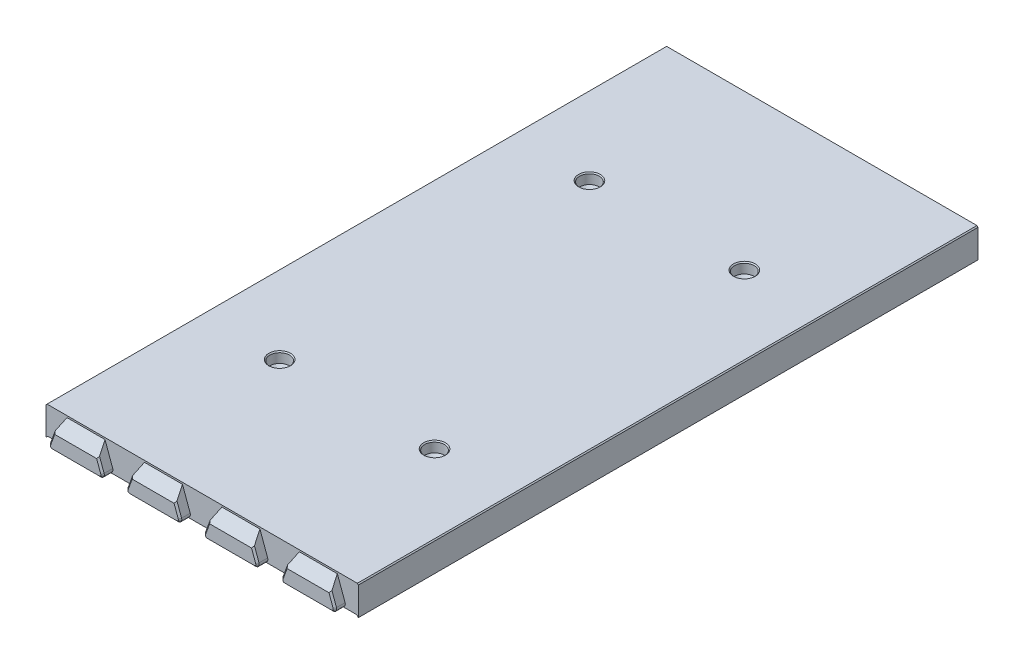
from build123d import *

# Parameters (mm, degrees)
BOSS_EXTRUDE1_DEPTH             = 90
SKETCH7_W                       = 86.75
SKETCH7_H                       = 6
BOSS_EXTRUDE7_DEPTH             = 1
BOSS_EXTRUDE4_DEPTH             = 3
BOSS_EXTRUDE8_REACH             = 103.108
BOSS_EXTRUDE8_DIRECTION_2_DEPTH = 2
CHAMFER4_SIZE                   = 0.5
FILLET4_R                       = 1
CHAMFER6_SIZE                   = 0.5
FILLET2_R                       = 2
CHAMFER4_OF_MIRROR2_SIZE        = 0.5
FILLET4_OF_MIRROR2_R            = 1
CHAMFER6_OF_MIRROR2_SIZE        = 0.5
FILLET2_OF_MIRROR2_R            = 2
BOSS_EXTRUDE9_REACH             = 190.711
SKETCH9_R                       = 5
FILLET3_R                       = 3
SKETCH10_R                      = 1.85
CUT_EXTRUDE2_DEPTH              = 189.711130104
SKETCH11_R                      = 2.85
CUT_EXTRUDE3_DEPTH              = 3
CHAMFER7_SIZE                   = 1
CUT_EXTRUDE4_DEPTH              = 189.711130104
CUT_EXTRUDE4_DEPTH_BACK         = 189.711130104
BOSS_EXTRUDE10_DEPTH            = 180
CHAMFER8_SIZE                   = 0.3


with BuildPart() as part:
    # Sketch1 → Boss-Extrude1 (new body)
    with BuildSketch(Plane.XY):
        Polygon((-45.375, 0), (-45.375, 8), (45.375, 8), (45.375, 0), (43.375, 0), (43.375, 6), (-43.375, 6), (-43.375, 0), align=None)
    boss_extrude1 = extrude(amount=-BOSS_EXTRUDE1_DEPTH)

    # Sketch7 → Boss-Extrude7 (add)
    with BuildSketch(Plane.XY):
        with Locations((0, 3)):
            Rectangle(SKETCH7_W, SKETCH7_H)
    boss_extrude7 = extrude(amount=-BOSS_EXTRUDE7_DEPTH)

    # Sketch2 → Boss-Extrude4 (add)
    with BuildSketch(Plane.XY):
        Polygon((28.411761874, 8), (25.5, 0), (42, 0), (39.088238126, 8), align=None)
        Polygon((5.911761874, 8), (3, 0), (19.5, 0), (16.588238126, 8), align=None)
        Polygon((-16.588238126, 8), (-19.5, 0), (-3, 0), (-5.911761874, 8), align=None)
        Polygon((-39.088238126, 8), (-42, 0), (-25.5, 0), (-28.411761874, 8), align=None)
    boss_extrude4 = extrude(amount=BOSS_EXTRUDE4_DEPTH)

    # Sketch8 → Boss-Extrude8 (add, up to next)
    with BuildSketch(Plane.XZ, mode=Mode.PRIVATE) as boss_extrude8_sk1:
        Polygon((-44, -24.955880937), (-44, -20.044119063), (-40, -21.5), (-40, -23.5), align=None)
    boss_extrude8_tool1 = extrude(boss_extrude8_sk1.sketch, amount=-BOSS_EXTRUDE8_REACH, mode=Mode.PRIVATE) - part.part
    # Sketch8 → Boss-Extrude8 (add, up to next)
    with BuildSketch(Plane.XZ, mode=Mode.PRIVATE) as boss_extrude8_sk2:
        Polygon((-44, -90), (-44, -87.544119063), (-40, -89), (-40, -90), align=None)
    boss_extrude8_tool2 = extrude(boss_extrude8_sk2.sketch, amount=-BOSS_EXTRUDE8_REACH, mode=Mode.PRIVATE) - part.part
    # Sketch8 → Boss-Extrude8 (add, up to next)
    with BuildSketch(Plane.XZ, mode=Mode.PRIVATE) as boss_extrude8_sk3:
        Polygon((44, -24.955880937), (40, -23.5), (40, -21.5), (44, -20.044119063), align=None)
    boss_extrude8_tool3 = extrude(boss_extrude8_sk3.sketch, amount=-BOSS_EXTRUDE8_REACH, mode=Mode.PRIVATE) - part.part
    # Sketch8 → Boss-Extrude8 (add, up to next)
    with BuildSketch(Plane.XZ, mode=Mode.PRIVATE) as boss_extrude8_sk4:
        Polygon((40, -90), (44, -90), (44, -87.544119063), (40, -89), align=None)
    boss_extrude8_tool4 = extrude(boss_extrude8_sk4.sketch, amount=-BOSS_EXTRUDE8_REACH, mode=Mode.PRIVATE) - part.part
    boss_extrude8_1 = boss_extrude8_tool1.solids().sort_by_distance((-42.280851, 0, -22.5))[0]
    add(boss_extrude8_1)
    boss_extrude8_2 = boss_extrude8_tool2.solids().sort_by_distance((-42.280851, 0, -89.084919))[0]
    add(boss_extrude8_2)
    boss_extrude8_3 = boss_extrude8_tool3.solids().sort_by_distance((42.280851, 0, -22.5))[0]
    add(boss_extrude8_3)
    boss_extrude8_4 = boss_extrude8_tool4.solids().sort_by_distance((42.280851, 0, -89.084919))[0]
    add(boss_extrude8_4)
    boss_extrude8 = boss_extrude8_1 + boss_extrude8_2 + boss_extrude8_3 + boss_extrude8_4  # Boss-Extrude8 as one shape, for the pattern or mirror that repeats it

    # Sketch8 → Boss-Extrude8 direction 2 (add)
    with BuildSketch(Plane.XZ):
        Polygon((-44, -24.955880937), (-44, -20.044119063), (-40, -21.5), (-40, -23.5), align=None)
        Polygon((-44, -90), (-44, -87.544119063), (-40, -89), (-40, -90), align=None)
        Polygon((44, -24.955880937), (40, -23.5), (40, -21.5), (44, -20.044119063), align=None)
        Polygon((40, -90), (44, -90), (44, -87.544119063), (40, -89), align=None)
    boss_extrude8_direction_2 = extrude(amount=BOSS_EXTRUDE8_DIRECTION_2_DEPTH)

    # Chamfer4
    chamfer4_edges = [part.edges().sort_by_distance(p)[0] for p in [
        (-40, -2, -89.5),
        (-42, -2, -88.272059531),
        (-44, -2, -88.772059531),
        (-42, -2, -20.772059531),
        (-44, -2, -22.5),
        (-42, -2, -24.227940469),
        (-40, -2, -22.5),
        (44, -2, -22.5),
        (42, -2, -20.772059531),
        (40, -2, -22.5),
        (42, -2, -24.227940469),
        (40, -2, -89.5),
        (44, -2, -88.772059531),
        (42, -2, -88.272059531),
    ]]
    chamfer(chamfer4_edges, length=CHAMFER4_SIZE)

    # Fillet4
    fillet4_edges = [part.edges().sort_by_distance(p)[0] for p in [
        (25.5, 0, 1.5),
        (42, 0, 1.5),
        (3, 0, 1.5),
        (19.5, 0, 1.5),
        (-19.5, 0, 1.5),
        (-3, 0, 1.5),
        (-42, 0, 1.5),
        (-25.5, 0, 1.5),
    ]]
    fillet(fillet4_edges, radius=FILLET4_R)

    # Chamfer6
    chamfer6_edges = [part.edges().sort_by_distance(p)[0] for p in [
        (40.29989137, 4.671010072, 3),
        (33.75, 0, 3),
        (11.25, 0, 3),
        (-11.25, 0, 3),
        (-33.75, 0, 3),
        (26.108995962, 0.426423564, 3),
        (41.391004038, 0.426423564, 3),
        (17.79989137, 4.671010072, 3),
        (3.608995962, 0.426423564, 3),
        (18.891004038, 0.426423564, 3),
        (-4.70010863, 4.671010072, 3),
        (-18.891004038, 0.426423564, 3),
        (-3.608995962, 0.426423564, 3),
        (-27.20010863, 4.671010072, 3),
        (-41.391004038, 0.426423564, 3),
        (-26.108995962, 0.426423564, 3),
        (27.20010863, 4.671010072, 3),
        (4.70010863, 4.671010072, 3),
        (-17.79989137, 4.671010072, 3),
        (-40.29989137, 4.671010072, 3),
    ]]
    chamfer(chamfer6_edges, length=CHAMFER6_SIZE)

    # Fillet2
    fillet2_edges = [part.edges().sort_by_distance(p)[0] for p in [
        (-43.375, 6, -56.25),
        (-43.375, 3, -87.771600459),
        (-40, 6, -89.5),
        (-41.6875, 6, -88.38580023),
        (-43.375, 6, -10.63580023),
        (-43.375, 3, -20.271600459),
        (-43.375, 3, -24.728399541),
        (-41.6875, 6, -20.88580023),
        (-40, 6, -22.5),
        (-41.6875, 6, -24.11419977),
        (43.375, 6, -10.63580023),
        (43.375, 3, -20.271600459),
        (43.375, 3, -24.728399541),
        (41.6875, 6, -20.88580023),
        (41.6875, 6, -24.11419977),
        (40, 6, -22.5),
        (43.375, 6, -56.25),
        (43.375, 3, -87.771600459),
        (40, 6, -89.5),
        (41.6875, 6, -88.38580023),
        (-43.375, 3, -1),
        (0, 6, -1),
        (43.375, 3, -1),
    ]]
    fillet(fillet2_edges, radius=FILLET2_R)


with BuildPart() as mirror2_1:
    # Mirror2: Boss-Extrude1, Boss-Extrude7, Boss-Extrude4, Boss-Extrude8, Boss-Extrude8 direction 2 across plane
    add(boss_extrude1.mirror(Plane.XY.offset(-90)))
    add(boss_extrude7.mirror(Plane.XY.offset(-90)))
    add(boss_extrude4.mirror(Plane.XY.offset(-90)))
    add(boss_extrude8.mirror(Plane.XY.offset(-90)))
    add(boss_extrude8_direction_2.mirror(Plane.XY.offset(-90)))

    # Chamfer4 of Mirror2
    chamfer4_of_mirror2_edges = [mirror2_1.edges().sort_by_distance(p)[0] for p in [
        (-40, -2, -90.5),
        (-42, -2, -91.727940469),
        (-44, -2, -91.227940469),
        (-42, -2, -159.227940469),
        (-44, -2, -157.5),
        (-42, -2, -155.772059531),
        (-40, -2, -157.5),
        (44, -2, -157.5),
        (42, -2, -159.227940469),
        (40, -2, -157.5),
        (42, -2, -155.772059531),
        (40, -2, -90.5),
        (44, -2, -91.227940469),
        (42, -2, -91.727940469),
    ]]
    chamfer(chamfer4_of_mirror2_edges, length=CHAMFER4_OF_MIRROR2_SIZE)

    # Fillet4 of Mirror2
    fillet4_of_mirror2_edges = [mirror2_1.edges().sort_by_distance(p)[0] for p in [
        (25.5, 0, -181.5),
        (42, 0, -181.5),
        (3, 0, -181.5),
        (19.5, 0, -181.5),
        (-19.5, 0, -181.5),
        (-3, 0, -181.5),
        (-42, 0, -181.5),
        (-25.5, 0, -181.5),
    ]]
    fillet(fillet4_of_mirror2_edges, radius=FILLET4_OF_MIRROR2_R)

    # Chamfer6 of Mirror2
    chamfer6_of_mirror2_edges = [mirror2_1.edges().sort_by_distance(p)[0] for p in [
        (40.29989137, 4.671010072, -183),
        (33.75, 0, -183),
        (11.25, 0, -183),
        (-11.25, 0, -183),
        (-33.75, 0, -183),
        (26.108995962, 0.426423564, -183),
        (41.391004038, 0.426423564, -183),
        (17.79989137, 4.671010072, -183),
        (3.608995962, 0.426423564, -183),
        (18.891004038, 0.426423564, -183),
        (-4.70010863, 4.671010072, -183),
        (-18.891004038, 0.426423564, -183),
        (-3.608995962, 0.426423564, -183),
        (-27.20010863, 4.671010072, -183),
        (-41.391004038, 0.426423564, -183),
        (-26.108995962, 0.426423564, -183),
        (27.20010863, 4.671010072, -183),
        (4.70010863, 4.671010072, -183),
        (-17.79989137, 4.671010072, -183),
        (-40.29989137, 4.671010072, -183),
    ]]
    chamfer(chamfer6_of_mirror2_edges, length=CHAMFER6_OF_MIRROR2_SIZE)

    # Fillet2 of Mirror2
    fillet2_of_mirror2_edges = [mirror2_1.edges().sort_by_distance(p)[0] for p in [
        (-43.375, 6, -123.75),
        (-43.375, 3, -92.228399541),
        (-40, 6, -90.5),
        (-41.6875, 6, -91.61419977),
        (-43.375, 6, -169.36419977),
        (-43.375, 3, -159.728399541),
        (-43.375, 3, -155.271600459),
        (-41.6875, 6, -159.11419977),
        (-40, 6, -157.5),
        (-41.6875, 6, -155.88580023),
        (43.375, 6, -169.36419977),
        (43.375, 3, -159.728399541),
        (43.375, 3, -155.271600459),
        (41.6875, 6, -159.11419977),
        (41.6875, 6, -155.88580023),
        (40, 6, -157.5),
        (43.375, 6, -123.75),
        (43.375, 3, -92.228399541),
        (40, 6, -90.5),
        (41.6875, 6, -91.61419977),
        (-43.375, 3, -179),
        (0, 6, -179),
        (43.375, 3, -179),
    ]]
    fillet(fillet2_of_mirror2_edges, radius=FILLET2_OF_MIRROR2_R)


with BuildPart() as part_1:
    add(part.part)

    # Mirror2 united with what the copies touc: union Mirror2_1
    add(mirror2_1.part)

    # Sketch9 → Boss-Extrude9 (add, up to next)
    with BuildSketch(Plane(origin=(0, 0, 0), x_dir=(1, 0, 0), z_dir=(0, 1, 0)), mode=Mode.PRIVATE) as boss_extrude9_sk1:
        with Locations(Location((-22.5, 45, 0), (0, 0, 90))):
            Circle(SKETCH9_R)
    boss_extrude9_tool1 = extrude(boss_extrude9_sk1.sketch, amount=BOSS_EXTRUDE9_REACH, mode=Mode.PRIVATE) - part_1.part
    # Sketch9 → Boss-Extrude9 (add, up to next)
    with BuildSketch(Plane(origin=(0, 0, 0), x_dir=(1, 0, 0), z_dir=(0, 1, 0)), mode=Mode.PRIVATE) as boss_extrude9_sk2:
        with Locations(Location((22.5, 45, 0), (0, 0, 90))):
            Circle(SKETCH9_R)
    boss_extrude9_tool2 = extrude(boss_extrude9_sk2.sketch, amount=BOSS_EXTRUDE9_REACH, mode=Mode.PRIVATE) - part_1.part
    # Sketch9 → Boss-Extrude9 (add, up to next)
    with BuildSketch(Plane(origin=(0, 0, 0), x_dir=(1, 0, 0), z_dir=(0, 1, 0)), mode=Mode.PRIVATE) as boss_extrude9_sk3:
        with Locations(Location((22.5, 135, 0), (0, 0, 90))):
            Circle(SKETCH9_R)
    boss_extrude9_tool3 = extrude(boss_extrude9_sk3.sketch, amount=BOSS_EXTRUDE9_REACH, mode=Mode.PRIVATE) - part_1.part
    # Sketch9 → Boss-Extrude9 (add, up to next)
    with BuildSketch(Plane(origin=(0, 0, 0), x_dir=(1, 0, 0), z_dir=(0, 1, 0)), mode=Mode.PRIVATE) as boss_extrude9_sk4:
        with Locations(Location((-22.5, 135, 0), (0, 0, 90))):
            Circle(SKETCH9_R)
    boss_extrude9_tool4 = extrude(boss_extrude9_sk4.sketch, amount=BOSS_EXTRUDE9_REACH, mode=Mode.PRIVATE) - part_1.part
    add(boss_extrude9_tool1.solids().sort_by_distance((-22.5, 0, -45))[0])
    add(boss_extrude9_tool2.solids().sort_by_distance((22.5, 0, -45))[0])
    add(boss_extrude9_tool3.solids().sort_by_distance((22.5, 0, -135))[0])
    add(boss_extrude9_tool4.solids().sort_by_distance((-22.5, 0, -135))[0])

    # Fillet3
    fillet3_edges = [part_1.edges().sort_by_distance(p)[0] for p in [
        (-22.5, 6, -130),
        (22.5, 6, -130),
        (22.5, 6, -40),
        (-22.5, 6, -40),
    ]]
    fillet(fillet3_edges, radius=FILLET3_R)

    # Sketch10 → Cut-Extrude2 (cut, through all)
    with BuildSketch(Plane(origin=(0, 0, 0), x_dir=(1, 0, 0), z_dir=(0, 1, 0))):
        with Locations(Location((-22.5, 135, 0), (0, 0, 270))):
            Circle(SKETCH10_R)
        with Locations(Location((-22.5, 45, 0), (0, 0, 270))):
            Circle(SKETCH10_R)
        with Locations(Location((22.5, 45, 0), (0, 0, 270))):
            Circle(SKETCH10_R)
        with Locations(Location((22.5, 135, 0), (0, 0, 270))):
            Circle(SKETCH10_R)
    extrude(amount=CUT_EXTRUDE2_DEPTH, mode=Mode.SUBTRACT)

    # Sketch11 → Cut-Extrude3 (cut)
    with BuildSketch(Plane(origin=(0, 8, 0), x_dir=(1, 0, 0), z_dir=(0, 1, 0))):
        with Locations(Location((-22.5, 135, 0), (0, 0, 270))):
            Circle(SKETCH11_R)
        with Locations(Location((22.5, 135, 0), (0, 0, 270))):
            Circle(SKETCH11_R)
        with Locations(Location((22.5, 45, 0), (0, 0, 270))):
            Circle(SKETCH11_R)
        with Locations(Location((-22.5, 45, 0), (0, 0, 270))):
            Circle(SKETCH11_R)
    extrude(amount=-CUT_EXTRUDE3_DEPTH, mode=Mode.SUBTRACT)

    # Chamfer7
    chamfer7_edges = [part_1.edges().sort_by_distance(p)[0] for p in [
        (-22.5, 5, -46.85),
        (22.5, 5, -46.85),
        (22.5, 5, -136.85),
        (-22.5, 5, -136.85),
    ]]
    chamfer(chamfer7_edges, length=CHAMFER7_SIZE - 0.0001)  # a hair under: the kernel refuses the full size

    # Sketch12 → Cut-Extrude4 (cut, two sides: drawn at the far end of the back side and taken through both)
    with BuildSketch(Plane(origin=(0, 0, 0), x_dir=(0, 0, -1), z_dir=(1, 0, 0)).offset(-CUT_EXTRUDE4_DEPTH_BACK)):
        Polygon((0, 7.5), (-3, 4.5), (-3, 7.5), (-3, 8), (0, 8), align=None)
        Polygon((183, 4.5), (183, 7.5), (183, 8), (180, 8), (180, 7.5), align=None)
    extrude(amount=CUT_EXTRUDE4_DEPTH + CUT_EXTRUDE4_DEPTH_BACK, mode=Mode.SUBTRACT)

    # Sketch13 → Boss-Extrude10 (add)
    with BuildSketch(Plane(origin=(0, 0, -180), x_dir=(-1, 0, 0), z_dir=(0, 0, -1))):
        Polygon((-44.875, 0), (-45.375, -0.5), (-45.375, 0), align=None)
        Polygon((45.375, 0), (44.875, 0), (45.375, -0.5), align=None)
    extrude(amount=-BOSS_EXTRUDE10_DEPTH)

    # Chamfer8
    chamfer8_edges = [part_1.edges().sort_by_distance(p)[0] for p in [
        (-45.375, 8, -90),
        (45.375, 8, -90),
        (-22.5, 8, -47.85),
        (22.5, 8, -47.85),
        (22.5, 8, -137.85),
        (-22.5, 8, -137.85),
    ]]
    chamfer(chamfer8_edges, length=CHAMFER8_SIZE)


solid = part_1.part
